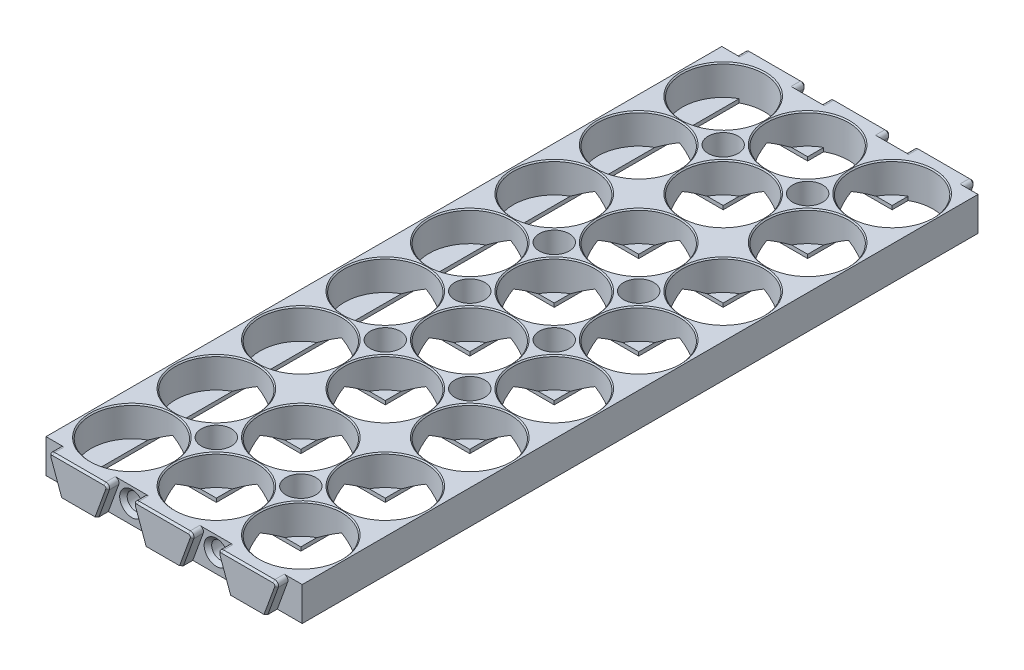
from build123d import *

# Parameters (mm, degrees)
SKETCH1_W                  = 22.5
SKETCH1_H                  = 22.5
SKETCH1_R                  = 10.875
BOSS_EXTRUDE1_DEPTH        = 8
SKETCH2_W                  = 6
SKETCH2_H                  = 6
BOSS_EXTRUDE2_DEPTH        = 1
CHAMFER2_SIZE              = 0.3
LPATTERN1_COUNT            = 8
LPATTERN1_PITCH            = 22.5
LPATTERN1_COUNT_DIR2       = 3
LPATTERN1_PITCH_DIR2       = 22.5
CHAMFER2_OF_LPATTERN1_SIZE = 0.3
SKETCH5_W                  = 6
SKETCH5_H                  = 1
BOSS_EXTRUDE3_DEPTH        = 168
BOSS_EXTRUDE4_START        = 1
BOSS_EXTRUDE4_DEPTH        = 1
CUT_EXTRUDE1_REACH         = 180.058
CUT_EXTRUDE7_REACH         = 180.058
BOSS_EXTRUDE5_DEPTH        = 3
BOSS_EXTRUDE6_DEPTH        = 3
FILLET1_R                  = 1
CHAMFER3_SIZE              = 0.5
SKETCH10_R                 = 2.25
CUT_EXTRUDE2_DEPTH         = 5
CUT_EXTRUDE3_START         = -5
SKETCH11_R                 = 2.25
CUT_EXTRUDE3_DEPTH         = 5
CHAMFER5_SIZE              = 1
SKETCH17_R                 = 4
CUT_EXTRUDE8_DEPTH         = 181.95061481
SKETCH18_R                 = 2.1
CUT_EXTRUDE9_DEPTH         = 4
SKETCH19_R                 = 1.7
CUT_EXTRUDE10_DEPTH        = 7
CHAMFER6_SIZE              = 1
SKETCH22_W                 = 0.375
SKETCH22_H                 = 180
BOSS_EXTRUDE7_DEPTH        = 9
CUT_EXTRUDE11_DEPTH        = 2
CHAMFER7_SIZE              = 0.5


with BuildPart() as part:
    # Sketch1 → Boss-Extrude1 (new body)
    with BuildSketch(Plane(origin=(0, 0, 0), x_dir=(1, 0, 0), z_dir=(0, 1, 0))):
        Rectangle(SKETCH1_W, SKETCH1_H)
        with Locations(Location((0, 0, 0), (0, 0, 270))):
            Circle(SKETCH1_R, mode=Mode.SUBTRACT)
    boss_extrude1 = extrude(amount=BOSS_EXTRUDE1_DEPTH)

    # Sketch2 → Boss-Extrude2 (add)
    with BuildSketch(Plane.XZ):
        with Locations((8.25, 8.25)):
            Rectangle(SKETCH2_W, SKETCH2_H)
        with Locations((8.25, -8.25)):
            Rectangle(SKETCH2_W, SKETCH2_H)
        with Locations((-8.25, -8.25)):
            Rectangle(SKETCH2_W, SKETCH2_H)
        with Locations((-8.25, 8.25)):
            Rectangle(SKETCH2_W, SKETCH2_H)
    boss_extrude2 = extrude(amount=BOSS_EXTRUDE2_DEPTH)

    # Chamfer2
    chamfer2_edges = [part.edges().sort_by_distance(p)[0] for p in [
        (0, 8, -10.875),
    ]]
    chamfer(chamfer2_edges, length=CHAMFER2_SIZE)

    # LPattern1: Boss-Extrude1, Boss-Extrude2 8 × 3
    with Locations(*[(j * LPATTERN1_PITCH_DIR2, 0, i * LPATTERN1_PITCH) for i in range(LPATTERN1_COUNT) for j in range(LPATTERN1_COUNT_DIR2) if (i, j) != (0, 0)]):
        add(boss_extrude1)
        add(boss_extrude2)

    # Chamfer2 of LPattern1
    chamfer2_of_lpattern1_edges = [part.edges().sort_by_distance(p)[0] for p in [
        (22.5, 8, -10.875),
        (45, 8, -10.875),
        (0, 8, 11.625),
        (22.5, 8, 11.625),
        (45, 8, 11.625),
        (0, 8, 34.125),
        (22.5, 8, 34.125),
        (45, 8, 34.125),
        (0, 8, 56.625),
        (22.5, 8, 56.625),
        (45, 8, 56.625),
        (0, 8, 79.125),
        (22.5, 8, 79.125),
        (45, 8, 79.125),
        (0, 8, 101.625),
        (22.5, 8, 101.625),
        (45, 8, 101.625),
        (0, 8, 124.125),
        (22.5, 8, 124.125),
        (45, 8, 124.125),
        (0, 8, 146.625),
        (22.5, 8, 146.625),
        (45, 8, 146.625),
    ]]
    chamfer(chamfer2_of_lpattern1_edges, length=CHAMFER2_OF_LPATTERN1_SIZE)

    # Sketch5 → Boss-Extrude3 (add)
    with BuildSketch(Plane.XY.offset(-5.25)):
        with Locations((-8.25, -0.5)):
            Rectangle(SKETCH5_W, SKETCH5_H)
        with Locations((53.25, -0.5)):
            Rectangle(SKETCH5_W, SKETCH5_H)
    extrude(amount=BOSS_EXTRUDE3_DEPTH)

    # Sketch6 → Boss-Extrude4 (add)
    with BuildSketch(Plane.XZ.offset(BOSS_EXTRUDE4_START)):
        with BuildLine():
            Line((39.75, -11.25), (50.25, -11.25))
            Line((50.25, -11.25), (50.25, -9.523818824))
            ThreePointArc((50.25, -9.523818824), (45, -10.875), (39.75, -9.523818824))
            Line((39.75, -9.523818824), (39.75, -11.25))
        make_face()
        with BuildLine():
            Line((17.25, -9.523818824), (17.25, -11.25))
            Line((17.25, -11.25), (27.75, -11.25))
            Line((27.75, -11.25), (27.75, -9.523818824))
            ThreePointArc((27.75, -9.523818824), (22.5, -10.875), (17.25, -9.523818824))
        make_face()
        with BuildLine():
            Line((-5.25, -9.523818824), (-5.25, -11.25))
            Line((-5.25, -11.25), (5.25, -11.25))
            Line((5.25, -11.25), (5.25, -9.523818824))
            ThreePointArc((5.25, -9.523818824), (0, -10.875), (-5.25, -9.523818824))
        make_face()
        with BuildLine():
            Line((5.25, 168.75), (-5.25, 168.75))
            Line((-5.25, 168.75), (-5.25, 167.023818824))
            ThreePointArc((-5.25, 167.023818824), (0, 168.375), (5.25, 167.023818824))
            Line((5.25, 167.023818824), (5.25, 168.75))
        make_face()
        with BuildLine():
            Line((27.75, 167.023818824), (27.75, 168.75))
            Line((27.75, 168.75), (17.25, 168.75))
            Line((17.25, 168.75), (17.25, 167.023818824))
            ThreePointArc((17.25, 167.023818824), (22.5, 168.375), (27.75, 167.023818824))
        make_face()
        with BuildLine():
            Line((50.25, 167.023818824), (50.25, 168.75))
            Line((50.25, 168.75), (39.75, 168.75))
            Line((39.75, 168.75), (39.75, 167.023818824))
            ThreePointArc((39.75, 167.023818824), (45, 168.375), (50.25, 167.023818824))
        make_face()
    extrude(amount=-BOSS_EXTRUDE4_DEPTH)

    # Cut-Extrude1: up to this face of the body (flat: up to its plane)
    cut_extrude1_end = Plane(part.part.faces().sort_by_distance((33.75, -0.5, 152.25))[0])
    # Sketch7 → Cut-Extrude1 (cut, up to the picked face)
    with BuildSketch(Plane.XY, mode=Mode.PRIVATE) as cut_extrude1_sk1:
        Polygon((-5.25, 0), (5.25, 0), (0, 3.031088913), align=None)
    cut_extrude1_tool1 = split(extrude(cut_extrude1_sk1.sketch, amount=CUT_EXTRUDE1_REACH, mode=Mode.PRIVATE), bisect_by=cut_extrude1_end, keep=Keep.BOTH, mode=Mode.PRIVATE)
    # Sketch7 → Cut-Extrude1 (cut, up to the picked face)
    with BuildSketch(Plane.XY, mode=Mode.PRIVATE) as cut_extrude1_sk2:
        Polygon((17.25, 0), (22.5, 3.031088913), (27.75, 0), align=None)
    cut_extrude1_tool2 = split(extrude(cut_extrude1_sk2.sketch, amount=CUT_EXTRUDE1_REACH, mode=Mode.PRIVATE), bisect_by=cut_extrude1_end, keep=Keep.BOTH, mode=Mode.PRIVATE)
    # Sketch7 → Cut-Extrude1 (cut, up to the picked face)
    with BuildSketch(Plane.XY, mode=Mode.PRIVATE) as cut_extrude1_sk3:
        Polygon((39.75, 0), (45, 3.031088913), (50.25, 0), align=None)
    cut_extrude1_tool3 = split(extrude(cut_extrude1_sk3.sketch, amount=CUT_EXTRUDE1_REACH, mode=Mode.PRIVATE), bisect_by=cut_extrude1_end, keep=Keep.BOTH, mode=Mode.PRIVATE)
    add(cut_extrude1_tool1.solids().sort_by(Axis((0, 1.010363, 0), (0, 0, 1)))[0], mode=Mode.SUBTRACT)
    add(cut_extrude1_tool2.solids().sort_by(Axis((22.5, 1.010363, 0), (0, 0, 1)))[0], mode=Mode.SUBTRACT)
    add(cut_extrude1_tool3.solids().sort_by(Axis((45, 1.010363, 0), (0, 0, 1)))[0], mode=Mode.SUBTRACT)

    # Cut-Extrude7: up to this face of the body (flat: up to its plane)
    cut_extrude7_end = Plane(part.part.faces().sort_by_distance((39.75, -0.5, -7.386909412))[0])
    # Sketch16 → Cut-Extrude7 (cut, up to the picked face)
    with BuildSketch(Plane(origin=(0, 0, 0), x_dir=(0, 0, -1), z_dir=(1, 0, 0)), mode=Mode.PRIVATE) as cut_extrude7_sk1:
        Polygon((-5.25, 0), (0, 3.031088913), (5.25, 0), align=None)
    cut_extrude7_tool1 = split(extrude(cut_extrude7_sk1.sketch, amount=CUT_EXTRUDE7_REACH, mode=Mode.PRIVATE), bisect_by=cut_extrude7_end, keep=Keep.BOTH, mode=Mode.PRIVATE)
    # Sketch16 → Cut-Extrude7 (cut, up to the picked face)
    with BuildSketch(Plane(origin=(0, 0, 0), x_dir=(0, 0, -1), z_dir=(1, 0, 0)), mode=Mode.PRIVATE) as cut_extrude7_sk2:
        Polygon((-22.5, 3.031088913), (-17.25, 0), (-27.75, 0), align=None)
    cut_extrude7_tool2 = split(extrude(cut_extrude7_sk2.sketch, amount=CUT_EXTRUDE7_REACH, mode=Mode.PRIVATE), bisect_by=cut_extrude7_end, keep=Keep.BOTH, mode=Mode.PRIVATE)
    # Sketch16 → Cut-Extrude7 (cut, up to the picked face)
    with BuildSketch(Plane(origin=(0, 0, 0), x_dir=(0, 0, -1), z_dir=(1, 0, 0)), mode=Mode.PRIVATE) as cut_extrude7_sk3:
        Polygon((-45, 3.031088913), (-39.75, 0), (-50.25, 0), align=None)
    cut_extrude7_tool3 = split(extrude(cut_extrude7_sk3.sketch, amount=CUT_EXTRUDE7_REACH, mode=Mode.PRIVATE), bisect_by=cut_extrude7_end, keep=Keep.BOTH, mode=Mode.PRIVATE)
    # Sketch16 → Cut-Extrude7 (cut, up to the picked face)
    with BuildSketch(Plane(origin=(0, 0, 0), x_dir=(0, 0, -1), z_dir=(1, 0, 0)), mode=Mode.PRIVATE) as cut_extrude7_sk4:
        Polygon((-67.5, 3.031088913), (-62.25, 0), (-72.75, 0), align=None)
    cut_extrude7_tool4 = split(extrude(cut_extrude7_sk4.sketch, amount=CUT_EXTRUDE7_REACH, mode=Mode.PRIVATE), bisect_by=cut_extrude7_end, keep=Keep.BOTH, mode=Mode.PRIVATE)
    # Sketch16 → Cut-Extrude7 (cut, up to the picked face)
    with BuildSketch(Plane(origin=(0, 0, 0), x_dir=(0, 0, -1), z_dir=(1, 0, 0)), mode=Mode.PRIVATE) as cut_extrude7_sk5:
        Polygon((-90, 3.031088913), (-84.75, 0), (-95.25, 0), align=None)
    cut_extrude7_tool5 = split(extrude(cut_extrude7_sk5.sketch, amount=CUT_EXTRUDE7_REACH, mode=Mode.PRIVATE), bisect_by=cut_extrude7_end, keep=Keep.BOTH, mode=Mode.PRIVATE)
    # Sketch16 → Cut-Extrude7 (cut, up to the picked face)
    with BuildSketch(Plane(origin=(0, 0, 0), x_dir=(0, 0, -1), z_dir=(1, 0, 0)), mode=Mode.PRIVATE) as cut_extrude7_sk6:
        Polygon((-112.5, 3.031088913), (-107.25, 0), (-117.75, 0), align=None)
    cut_extrude7_tool6 = split(extrude(cut_extrude7_sk6.sketch, amount=CUT_EXTRUDE7_REACH, mode=Mode.PRIVATE), bisect_by=cut_extrude7_end, keep=Keep.BOTH, mode=Mode.PRIVATE)
    # Sketch16 → Cut-Extrude7 (cut, up to the picked face)
    with BuildSketch(Plane(origin=(0, 0, 0), x_dir=(0, 0, -1), z_dir=(1, 0, 0)), mode=Mode.PRIVATE) as cut_extrude7_sk7:
        Polygon((-135, 3.031088913), (-129.75, 0), (-140.25, 0), align=None)
    cut_extrude7_tool7 = split(extrude(cut_extrude7_sk7.sketch, amount=CUT_EXTRUDE7_REACH, mode=Mode.PRIVATE), bisect_by=cut_extrude7_end, keep=Keep.BOTH, mode=Mode.PRIVATE)
    # Sketch16 → Cut-Extrude7 (cut, up to the picked face)
    with BuildSketch(Plane(origin=(0, 0, 0), x_dir=(0, 0, -1), z_dir=(1, 0, 0)), mode=Mode.PRIVATE) as cut_extrude7_sk8:
        Polygon((-157.5, 3.031088913), (-152.25, 0), (-162.75, 0), align=None)
    cut_extrude7_tool8 = split(extrude(cut_extrude7_sk8.sketch, amount=CUT_EXTRUDE7_REACH, mode=Mode.PRIVATE), bisect_by=cut_extrude7_end, keep=Keep.BOTH, mode=Mode.PRIVATE)
    add(cut_extrude7_tool1.solids().sort_by(Axis((0, 1.010363, 0), (1, 0, 0)))[0], mode=Mode.SUBTRACT)
    add(cut_extrude7_tool2.solids().sort_by(Axis((0, 1.010363, 22.5), (1, 0, 0)))[0], mode=Mode.SUBTRACT)
    add(cut_extrude7_tool3.solids().sort_by(Axis((0, 1.010363, 45), (1, 0, 0)))[0], mode=Mode.SUBTRACT)
    add(cut_extrude7_tool4.solids().sort_by(Axis((0, 1.010363, 67.5), (1, 0, 0)))[0], mode=Mode.SUBTRACT)
    add(cut_extrude7_tool5.solids().sort_by(Axis((0, 1.010363, 90), (1, 0, 0)))[0], mode=Mode.SUBTRACT)
    add(cut_extrude7_tool6.solids().sort_by(Axis((0, 1.010363, 112.5), (1, 0, 0)))[0], mode=Mode.SUBTRACT)
    add(cut_extrude7_tool7.solids().sort_by(Axis((0, 1.010363, 135), (1, 0, 0)))[0], mode=Mode.SUBTRACT)
    add(cut_extrude7_tool8.solids().sort_by(Axis((0, 1.010363, 157.5), (1, 0, 0)))[0], mode=Mode.SUBTRACT)

    # Sketch8 → Boss-Extrude5 (add)
    with BuildSketch(Plane(origin=(0, 0, -11.25), x_dir=(-1, 0, 0), z_dir=(0, 0, -1))):
        Polygon((-27.474267892, -1), (-30.75, 8), (-14.25, 8), (-17.525732108, -1), align=None)
        Polygon((4.974267892, -1), (-4.974267892, -1), (-8.25, 8), (8.25, 8), align=None)
        Polygon((-49.974267892, -1), (-53.25, 8), (-36.75, 8), (-40.025732108, -1), align=None)
    extrude(amount=BOSS_EXTRUDE5_DEPTH)

    # Sketch9 → Boss-Extrude6 (add)
    with BuildSketch(Plane.XY.offset(168.75)):
        Polygon((-4.974267892, -1), (4.974267892, -1), (8.25, 8), (-8.25, 8), align=None)
        Polygon((49.974267892, -1), (53.25, 8), (36.75, 8), (40.025732108, -1), align=None)
        Polygon((14.25, 8), (17.525732108, -1), (27.474267892, -1), (30.75, 8), align=None)
    extrude(amount=BOSS_EXTRUDE6_DEPTH)

    # Fillet1
    fillet1_edges = [part.edges().sort_by_distance(p)[0] for p in [
        (-8.25, 8, -12.75),
        (8.25, 8, -12.75),
        (14.25, 8, -12.75),
        (30.75, 8, -12.75),
        (36.75, 8, -12.75),
        (53.25, 8, -12.75),
        (-8.25, 8, 170.25),
        (8.25, 8, 170.25),
        (53.25, 8, 170.25),
        (36.75, 8, 170.25),
        (30.75, 8, 170.25),
        (14.25, 8, 170.25),
    ]]
    fillet(fillet1_edges, radius=FILLET1_R)

    # Chamfer3
    chamfer3_edges = [part.edges().sort_by_distance(p)[0] for p in [
        (-6.367906253, 2.828989928, -14.25),
        (16.132093747, 2.828989928, -14.25),
        (38.632093747, 2.828989928, -14.25),
        (6.367906253, 2.828989928, 171.75),
        (51.367906253, 2.828989928, 171.75),
        (28.867906253, 2.828989928, 171.75),
        (45, 8, -14.25),
        (22.5, 8, -14.25),
        (0, 8, -14.25),
        (0, 8, 171.75),
        (22.5, 8, 171.75),
        (45, 8, 171.75),
        (6.367906253, 2.828989928, -14.25),
        (7.641004038, 7.573576436, -14.25),
        (-7.641004038, 7.573576436, -14.25),
        (51.367906253, 2.828989928, -14.25),
        (52.641004038, 7.573576436, -14.25),
        (37.358995962, 7.573576436, -14.25),
        (28.867906253, 2.828989928, -14.25),
        (14.858995962, 7.573576436, -14.25),
        (30.141004038, 7.573576436, -14.25),
        (-6.367906253, 2.828989928, 171.75),
        (7.641004038, 7.573576436, 171.75),
        (-7.641004038, 7.573576436, 171.75),
        (16.132093747, 2.828989928, 171.75),
        (30.141004038, 7.573576436, 171.75),
        (14.858995962, 7.573576436, 171.75),
        (38.632093747, 2.828989928, 171.75),
        (52.641004038, 7.573576436, 171.75),
        (37.358995962, 7.573576436, 171.75),
    ]]
    chamfer(chamfer3_edges, length=CHAMFER3_SIZE)

    # Sketch10 → Cut-Extrude2 (cut)
    with BuildSketch(Plane(origin=(0, 0, -11.25), x_dir=(-1, 0, 0), z_dir=(0, 0, -1))):
        with Locations((-11.25, 4)):
            Circle(SKETCH10_R)
        with Locations(Location((-33.75, 4, 0), (0, 0, 180))):
            Circle(SKETCH10_R)
    extrude(amount=-CUT_EXTRUDE2_DEPTH, mode=Mode.SUBTRACT)

    # Sketch11 → Cut-Extrude3 (cut)
    with BuildSketch(Plane.XY.offset(168.75).offset(CUT_EXTRUDE3_START)):
        with Locations(Location((11.25, 4, 0), (0, 0, 180))):
            Circle(SKETCH11_R)
        with Locations((33.75, 4)):
            Circle(SKETCH11_R)
    extrude(amount=CUT_EXTRUDE3_DEPTH, mode=Mode.SUBTRACT)

    # Chamfer5
    chamfer5_edges = [part.edges().sort_by_distance(p)[0] for p in [
        (31.5, 4, -11.25),
        (13.5, 4, -11.25),
        (13.5, 4, 168.75),
        (31.5, 4, 168.75),
    ]]
    chamfer(chamfer5_edges, length=CHAMFER5_SIZE)

    # Sketch17 → Cut-Extrude8 (cut, through all)
    with BuildSketch(Plane.XZ.offset(1)):
        with Locations(Location((11.25, 11.25, 0), (0, 0, 270))):
            Circle(SKETCH17_R)
        with Locations(Location((33.75, 11.25, 0), (0, 0, 270))):
            Circle(SKETCH17_R)
        with Locations(Location((11.25, 56.25, 0), (0, 0, 270))):
            Circle(SKETCH17_R)
        with Locations(Location((33.75, 56.25, 0), (0, 0, 270))):
            Circle(SKETCH17_R)
        with Locations(Location((11.25, 78.75, 0), (0, 0, 270))):
            Circle(SKETCH17_R)
        with Locations(Location((33.75, 78.75, 0), (0, 0, 270))):
            Circle(SKETCH17_R)
        with Locations(Location((11.25, 101.25, 0), (0, 0, 270))):
            Circle(SKETCH17_R)
        with Locations(Location((33.75, 101.25, 0), (0, 0, 270))):
            Circle(SKETCH17_R)
        with Locations(Location((11.25, 146.25, 0), (0, 0, 270))):
            Circle(SKETCH17_R)
        with Locations(Location((33.75, 146.25, 0), (0, 0, 270))):
            Circle(SKETCH17_R)
    extrude(amount=-CUT_EXTRUDE8_DEPTH, mode=Mode.SUBTRACT)

    # Sketch18 → Cut-Extrude9 (cut)
    with BuildSketch(Plane.XZ.offset(1)):
        with Locations(Location((11.25, 33.75, 0), (0, 0, 270))):
            Circle(SKETCH18_R)
        with Locations(Location((33.75, 33.75, 0), (0, 0, 270))):
            Circle(SKETCH18_R)
        with Locations(Location((33.75, 123.75, 0), (0, 0, 270))):
            Circle(SKETCH18_R)
        with Locations(Location((11.25, 123.75, 0), (0, 0, 270))):
            Circle(SKETCH18_R)
    extrude(amount=-CUT_EXTRUDE9_DEPTH, mode=Mode.SUBTRACT)

    # Sketch19 → Cut-Extrude10 (cut)
    with BuildSketch(Plane.XZ.offset(1)):
        with Locations(Location((33.75, 123.75, 0), (0, 0, 270))):
            Circle(SKETCH19_R)
        with Locations(Location((11.25, 33.75, 0), (0, 0, 270))):
            Circle(SKETCH19_R)
        with Locations(Location((11.25, 123.75, 0), (0, 0, 270))):
            Circle(SKETCH19_R)
        with Locations(Location((33.75, 33.75, 0), (0, 0, 270))):
            Circle(SKETCH19_R)
    extrude(amount=-CUT_EXTRUDE10_DEPTH, mode=Mode.SUBTRACT)

    # Chamfer6
    chamfer6_edges = [part.edges().sort_by_distance(p)[0] for p in [
        (11.25, -1, 125.85),
        (33.75, -1, 125.85),
        (33.75, -1, 35.85),
        (11.25, -1, 35.85),
    ]]
    chamfer(chamfer6_edges, length=CHAMFER6_SIZE)

    # Sketch22 → Boss-Extrude7 (add)
    with BuildSketch(Plane(origin=(0, 8, 0), x_dir=(1, 0, 0), z_dir=(0, 1, 0))):
        with Locations((-11.4375, -78.75)):
            Rectangle(SKETCH22_W, SKETCH22_H)
        with Locations((56.4375, -78.75)):
            Rectangle(SKETCH22_W, SKETCH22_H)
    extrude(amount=-BOSS_EXTRUDE7_DEPTH)

    # Sketch14 → Cut-Extrude11 (cut)
    with BuildSketch(Plane.XZ.offset(1)):
        Polygon((-10.25, 76.294119063), (-10.25, 81.205880937), (-6.25, 79.75), (-6.25, 77.75), align=None)
        Polygon((-6.25, 10.25), (-6.25, 12.25), (-10.25, 13.705880937), (-10.25, 8.794119063), align=None)
        Polygon((-10.25, 148.705880937), (-6.25, 147.25), (-6.25, 145.25), (-10.25, 143.794119063), align=None)
        Polygon((55.25, 76.294119063), (51.25, 77.75), (51.25, 79.75), (55.25, 81.205880937), align=None)
        Polygon((55.25, 8.794119063), (51.25, 10.25), (51.25, 12.25), (55.25, 13.705880937), align=None)
        Polygon((51.25, 147.25), (51.25, 145.25), (55.25, 143.794119063), (55.25, 148.705880937), align=None)
    extrude(amount=-CUT_EXTRUDE11_DEPTH, mode=Mode.SUBTRACT)

    # Chamfer7
    chamfer7_edges = [part.edges().sort_by_distance(p)[0] for p in [
        (-8.25, -1, 80.477940469),
        (-10.25, -1, 78.75),
        (-8.25, -1, 77.022059531),
        (-6.25, -1, 78.75),
        (-10.25, -1, 146.25),
        (-8.25, -1, 144.522059531),
        (-6.25, -1, 146.25),
        (-8.25, -1, 147.977940469),
        (55.25, -1, 78.75),
        (53.25, -1, 80.477940469),
        (51.25, -1, 78.75),
        (53.25, -1, 77.022059531),
        (55.25, -1, 11.25),
        (53.25, -1, 12.977940469),
        (51.25, -1, 11.25),
        (53.25, -1, 9.522059531),
        (53.25, -1, 147.977940469),
        (51.25, -1, 146.25),
        (53.25, -1, 144.522059531),
        (55.25, -1, 146.25),
        (-8.25, -1, 12.977940469),
        (-10.25, -1, 11.25),
        (-8.25, -1, 9.522059531),
        (-6.25, -1, 11.25),
    ]]
    chamfer(chamfer7_edges, length=CHAMFER7_SIZE)


solid = part.part
